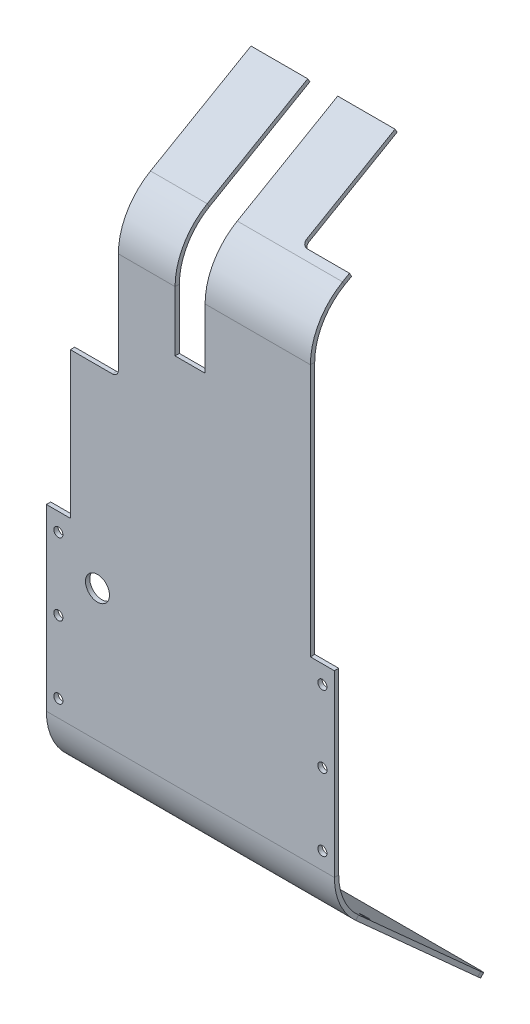
from build123d import *

# Parameters (mm, degrees)
BASE_FLANGE1_DEPTH = 2.286
SKETCH6_R          = 6.35
CUT_EXTRUDE1_DEPTH = 275.752517361
EDGE_FLANGE1_DEPTH = 152.4
FILLET1_R          = 6.35
EDGE_FLANGE2_DEPTH = 127
UNFOLD1_START      = 12.7
UNFOLD1_DEPTH      = 127
UNFOLD1_2_DEPTH    = 127
SKETCH15_W         = 25.4
SKETCH15_H         = 152.4
SKETCH15_H_2       = 57.15
CUT_EXTRUDE2_DEPTH = 2.54
FOLD1_START        = 38.1
FOLD1_DEPTH        = 101.6
FOLD1_2_DEPTH      = 76.2
FOLD1_START_2      = 114.3
FOLD1_3_DEPTH      = 25.4
FILLET2_R          = 3.175
SKETCH16_W         = 15.875
SKETCH16_H         = 203.2
CUT_EXTRUDE3_DEPTH = 337.68309673
SKETCH17_R         = 2.413
CUT_EXTRUDE4_DEPTH = 337.68309673
SKETCH18_R         = 2.413
CUT_EXTRUDE5_DEPTH = 2.54


# Read off the part's stored shape, not the designer's step: Unfold1, Fold1
# Sheet-metal steps are written as plain solids
with BuildPart() as part:
    # Sketch1 → Base-Flange1 (new body)
    with BuildSketch(Plane.XY):
        Polygon((139.7, 94.742), (152.4, 94.742), (152.4, 0), (0, 0), (0, 94.742), (12.7, 94.742), (12.7, 228.6), (139.7, 228.6), align=None)
    extrude(amount=-BASE_FLANGE1_DEPTH)

    # Sketch6 → Cut-Extrude1 (cut, through all)
    with BuildSketch(Plane.XY):
        with Locations((27.051, 69.85)):
            Circle(SKETCH6_R)
    extrude(amount=-CUT_EXTRUDE1_DEPTH, mode=Mode.SUBTRACT)

    # Edge-Flange1 section (across the edge) → Edge-Flange1 (add)
    with BuildSketch(Plane(origin=(152.4, -14.136010759, -2.286), x_dir=(0, 0.7431448254773909, -0.6691306063588619), z_dir=(-1, 0, 0))):
        with BuildLine():
            Line((-2.286, 14.136010759), (-2.286, 107.440207225))
            Line((-2.286, 107.440207225), (0, 107.440207225))
            Line((0, 107.440207225), (0, 14.136010759))
            ThreePointArc((0, 14.136010759), (2.74493172, 1.222122341), (10.505103248, -9.45883745))
            Line((10.505103248, -9.45883745), (8.975470682, -11.157666521))
            ThreePointArc((8.975470682, -11.157666521), (0.656566804, 0.292322375), (-2.286, 14.136010759))
        make_face()
    extrude(amount=EDGE_FLANGE1_DEPTH)

    # Fillet1
    fillet1_edges = [part.edges().sort_by_distance(p)[0] for p in [
        (152.4, -86.876956302, -81.364817765),
        (0, -86.876956302, -81.364817765),
    ]]
    fillet(fillet1_edges, radius=FILLET1_R)

    # Edge-Flange2 section (across the edge) → Edge-Flange2 (add)
    with BuildSketch(Plane(origin=(12.7, 246.930871047, -2.286), x_dir=(0, -0.8660254037844364, -0.5000000000000041), z_dir=(1, 0, 0))):
        with BuildLine():
            Line((-2.286, 18.330871047), (-2.286, 79.706177285))
            Line((-2.286, 79.706177285), (0, 79.706177285))
            Line((0, 79.706177285), (0, 18.330871047))
            ThreePointArc((0, 18.330871047), (4.25369343, 2.455871047), (15.875, -9.165435523))
            Line((15.875, -9.165435523), (14.732, -11.145169596))
            ThreePointArc((14.732, -11.145169596), (2.273959357, 1.312871047), (-2.286, 18.330871047))
        make_face()
    extrude(amount=EDGE_FLANGE2_DEPTH)

    # Unfold1 outline → Unfold1 (cut)
    with BuildSketch(Plane.YZ.offset(UNFOLD1_START)):
        with BuildLine():
            Line((240.863229427, -2.286), (228.6, -2.286))
            ThreePointArc((228.6, -2.286), (244.475, -6.53969343), (256.09630657, -18.161))
            Line((256.09630657, -18.161), (286.783959689, -71.313574367))
            Line((286.783959689, -71.313574367), (288.763693762, -70.170574367))
            Line((288.763693762, -70.170574367), (258.076040643, -17.018))
            ThreePointArc((258.076040643, -17.018), (250.731417092, -8.177738777), (240.863229427, -2.286))
        make_face()
    extrude(amount=UNFOLD1_DEPTH, mode=Mode.SUBTRACT)

    # Unfold1 2 outline → Unfold1 2 (add)
    with BuildSketch(Plane.YZ.offset(UNFOLD1_START)):
        with BuildLine():
            ThreePointArc((228.6, 0), (234.837238812, -0.576380337), (240.863229427, -2.286))
            Line((240.863229427, -2.286), (324.420775289, -2.286))
            Line((324.420775289, -2.286), (324.420775289, 0))
            Line((324.420775289, 0), (228.6, 0))
        make_face()
    extrude(amount=UNFOLD1_2_DEPTH)

    # Sketch15 → Cut-Extrude2 (cut)
    with BuildSketch(Plane.XY):
        with Locations((25.4, 248.220775289)):
            Rectangle(SKETCH15_W, SKETCH15_H)
        with Locations((127, 295.845775289)):
            Rectangle(SKETCH15_W, SKETCH15_H_2)
    extrude(amount=-CUT_EXTRUDE2_DEPTH, mode=Mode.SUBTRACT)

    # Fold1 outline → Fold1 (cut)
    with BuildSketch(Plane.YZ.offset(FOLD1_START)):
        with BuildLine():
            ThreePointArc((228.6, 0), (234.837238812, -0.576380337), (240.863229427, -2.286))
            Line((240.863229427, -2.286), (324.420775289, -2.286))
            Line((324.420775289, -2.286), (324.420775289, 0))
            Line((324.420775289, 0), (228.6, 0))
        make_face()
    extrude(amount=FOLD1_DEPTH, mode=Mode.SUBTRACT)

    # Fold1 2 outline → Fold1 2 (add)
    with BuildSketch(Plane.YZ.offset(FOLD1_START)):
        with BuildLine():
            ThreePointArc((228.6, -2.286), (244.475, -6.53969343), (256.09630657, -18.161))
            Line((256.09630657, -18.161), (286.783959689, -71.313574367))
            Line((286.783959689, -71.313574367), (288.763693762, -70.170574367))
            Line((288.763693762, -70.170574367), (258.076040643, -17.018))
            ThreePointArc((258.076040643, -17.018), (250.731417092, -8.177738777), (240.863229427, -2.286))
            Line((240.863229427, -2.286), (228.6, -2.286))
        make_face()
    extrude(amount=FOLD1_2_DEPTH)

    # Fold1 3 outline → Fold1 3 (add)
    with BuildSketch(Plane.YZ.offset(FOLD1_START_2)):
        with BuildLine():
            ThreePointArc((228.6, -2.286), (244.475, -6.53969343), (256.09630657, -18.161))
            Line((256.09630657, -18.161), (258.208959689, -21.820222541))
            Line((258.208959689, -21.820222541), (260.188693762, -20.677222541))
            Line((260.188693762, -20.677222541), (258.076040643, -17.018))
            ThreePointArc((258.076040643, -17.018), (250.731417092, -8.177738777), (240.863229427, -2.286))
            Line((240.863229427, -2.286), (228.6, -2.286))
        make_face()
    extrude(amount=FOLD1_3_DEPTH)

    # Fillet2
    fillet2_edges = [part.edges().sort_by_distance(p)[0] for p in [
        (38.1, 172.020775289, -1.143),
        (114.3, 259.198826725, -21.248722541),
    ]]
    fillet(fillet2_edges, radius=FILLET2_R)

    # Sketch16 → Cut-Extrude3 (cut, through all)
    with BuildSketch(Plane.XY):
        with Locations((76.04125, 298.45)):
            Rectangle(SKETCH16_W, SKETCH16_H)
    extrude(amount=-CUT_EXTRUDE3_DEPTH, mode=Mode.SUBTRACT)

    # Sketch17 → Cut-Extrude4 (cut, through all)
    with BuildSketch(Plane.XY):
        with Locations((6.35, 85.217)):
            Circle(SKETCH17_R)
        with Locations((6.35, 47.117)):
            Circle(SKETCH17_R)
        with Locations((6.35, 9.017)):
            Circle(SKETCH17_R)
        with Locations((146.05, 47.117)):
            Circle(SKETCH17_R)
        with Locations((146.05, 9.017)):
            Circle(SKETCH17_R)
        with Locations((146.05, 85.217)):
            Circle(SKETCH17_R)
    extrude(amount=-CUT_EXTRUDE4_DEPTH, mode=Mode.SUBTRACT)

    # Sketch18 → Cut-Extrude5 (cut)
    with BuildSketch(Plane(origin=(0, -8.368903665, 7.535394706), x_dir=(1, 0, 0), z_dir=(0, -0.7431448254773909, 0.6691306063588619))):
        with Locations(Location((6.35, -37.99367728, 0), (0, 0, 270))):
            Circle(SKETCH18_R)
        with Locations(Location((146.05, -37.99367728, 0), (0, 0, 270))):
            Circle(SKETCH18_R)
    extrude(amount=-CUT_EXTRUDE5_DEPTH, mode=Mode.SUBTRACT)


solid = part.part
